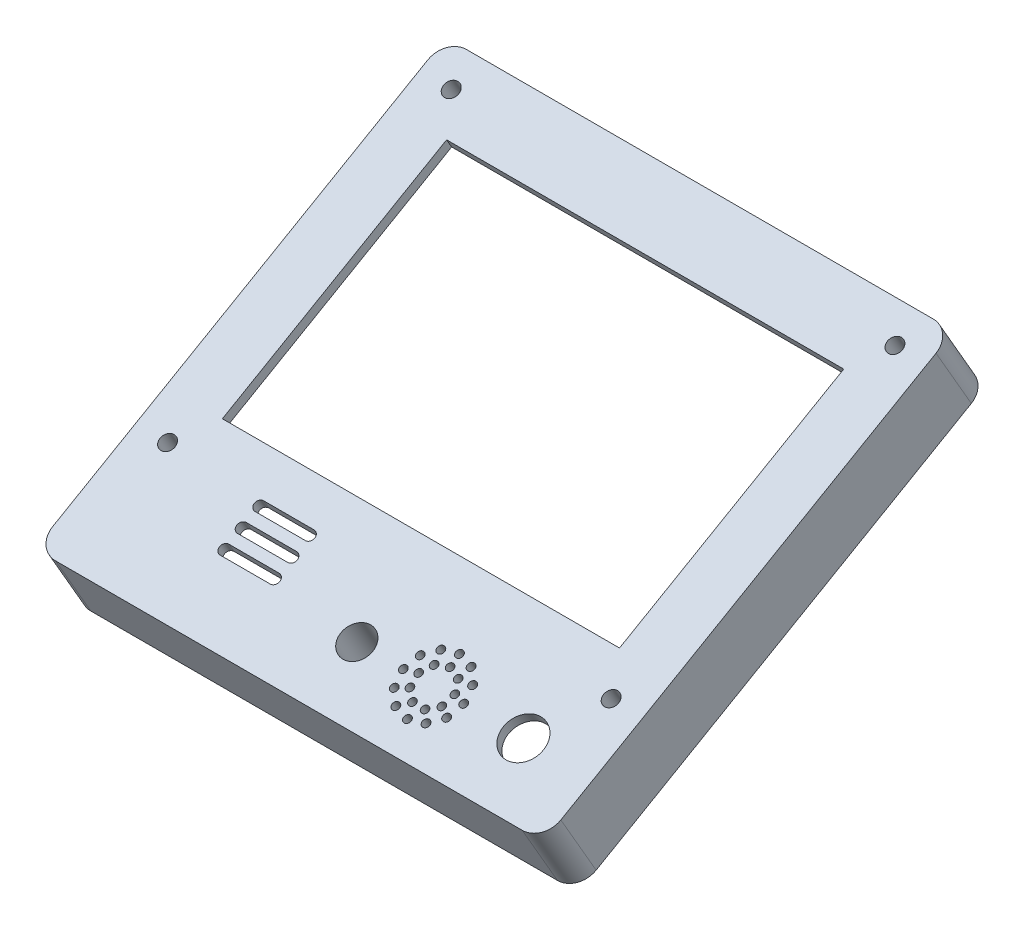
from build123d import *

# Parameters (mm, degrees)
SKETCH3_W           = 100751.030623597
SKETCH3_H           = 94095.793284763
BOSS_EXTRUDE1_DEPTH = 14000
SHELL1_T            = -2000
SKETCH5_R           = 1501.792292058
SKETCH5_R_2         = 1493.687333369
SKETCH5_R_3         = 1490.724890678
SKETCH5_R_4         = 3982.172835147
SKETCH5_R_5         = 3170.60939126
SKETCH5_R_6         = 1490.363986071
SKETCH5_R_7         = 737.911888342
SKETCH5_R_8         = 740.868588869
SKETCH5_R_9         = 724.590945863
SKETCH5_R_10        = 724.125890616
SKETCH5_R_11        = 734.985503275
SKETCH5_W           = 78736.278232061
SKETCH5_H           = 51336.053407304
CUT_EXTRUDE1_DEPTH  = 118262.071441258
SKETCH7_R           = 3521.682434345
SKETCH7_R_2         = 3500
SKETCH7_R_3         = 4000
BOSS_EXTRUDE2_DEPTH = 6300
SKETCH8_R           = 3170.60939126
SKETCH8_R_2         = 1490.363986071
SKETCH8_R_3         = 1501.792292058
SKETCH8_R_4         = 1493.687333369
SKETCH8_R_5         = 1490.724890678
CUT_EXTRUDE2_DEPTH  = 118101.300670381
FILLET1_R           = 4100


with BuildPart() as part:
    # Sketch3 → Boss-Extrude1 (new body)
    with BuildSketch(Plane(origin=(0, 38745.976565316, 22370), x_dir=(1, 0, 0), z_dir=(0, 0.866025403784438, 0.500000000000001))):
        with Locations((0.672101581, -53368.424582)):
            Rectangle(SKETCH3_W, SKETCH3_H)
    extrude(amount=BOSS_EXTRUDE1_DEPTH)

    # Shell1
    shell1_openings = [part.faces().sort_by_distance(p)[0] for p in [
        (0.672101581, 12061.764274316, 68588.411447965),
    ]]
    offset(amount=SHELL1_T, openings=shell1_openings, kind=Kind.INTERSECTION)

    # Sketch5 → Cut-Extrude1 (cut, through all)
    with BuildSketch(Plane(origin=(0, 50870.332218298, 29370), x_dir=(1, 0, 0), z_dir=(0, 0.8660254037844382, 0.500000000000001))):
        with Locations((-43988.642988716, -12447.86118339)):
            Circle(SKETCH5_R)
        with Locations((43969.858921507, -12425.496648286)):
            Circle(SKETCH5_R_2)
        with Locations((43990.171869975, -77427.118367554)):
            Circle(SKETCH5_R_3)
        with Locations((36420.678996585, -88766.891638688)):
            Circle(SKETCH5_R_4)
        with Locations((3383.428748484, -88760.799065072)):
            Circle(SKETCH5_R_5)
        with Locations((-43960.990588159, -77415.562559785)):
            Circle(SKETCH5_R_6)
        with Locations((12622.70964354, -88782.736651262)):
            Circle(SKETCH5_R_7)
        with Locations((13435.125802779, -91791.685227628)):
            Circle(SKETCH5_R_8)
        with Locations((15520.940800859, -90608.093588528)):
            Circle(SKETCH5_R_9)
        with Locations((15113.59271346, -88150.559972676)):
            Circle(SKETCH5_R_10)
        with Locations((16340.174739396, -86021.618091901)):
            Circle(SKETCH5_R_11)
        with Locations((18752.643650656, -85141.082169193)):
            Circle(SKETCH5_R_10)
        with Locations((21107.567803853, -86017.311065275)):
            Circle(SKETCH5_R_10)
        with Locations((22348.315287725, -88202.257409446)):
            Circle(SKETCH5_R_10)
        with Locations((21894.326565197, -90673.560524293)):
            Circle(SKETCH5_R_10)
        with Locations((19958.028005061, -92274.870216907)):
            Circle(SKETCH5_R_10)
        with Locations((17445.435223167, -92256.915885536)):
            Circle(SKETCH5_R_10)
        with Locations((13411.848268246, -85818.035470049)):
            Circle(SKETCH5_R_8)
        with Locations((15589.835663855, -83623.007736487)):
            Circle(SKETCH5_R_8)
        with Locations((18573.541944355, -82811.051655016)):
            Circle(SKETCH5_R_8)
        with Locations((21563.485421435, -83599.730201955)):
            Circle(SKETCH5_R_8)
        with Locations((23758.513154996, -85777.717597564)):
            Circle(SKETCH5_R_8)
        with Locations((24570.469236467, -88761.423878064)):
            Circle(SKETCH5_R_8)
        with Locations((23781.790689528, -91751.367355144)):
            Circle(SKETCH5_R_8)
        with Locations((21603.803293919, -93946.395088705)):
            Circle(SKETCH5_R_8)
        with Locations((18620.097013419, -94758.351170176)):
            Circle(SKETCH5_R_8)
        with Locations((15630.15353634, -93969.672623237)):
            Circle(SKETCH5_R_8)
        with BuildLine():
            Line((-24605.495027879, -77761.15742212), (-14621.25981654, -77761.15742212))
            ThreePointArc((-14621.25981654, -77761.15742212), (-13633.25454866, -78749.16269), (-14621.25981654, -79737.16795788))
            Line((-14621.25981654, -79737.16795788), (-24605.495027879, -79737.167957879))
            ThreePointArc((-24605.495027879, -79737.167957879), (-25593.500295759, -78749.16269), (-24605.495027879, -77761.15742212))
        make_face()
        with Locations((238.728370746, -44780.829769233)):
            Rectangle(SKETCH5_W, SKETCH5_H)
        with BuildLine():
            Line((-24597.360469483, -81751.779593879), (-14620.865597251, -81751.779593879))
            ThreePointArc((-14620.865597251, -81751.779593879), (-13613.569009088, -82759.076182042), (-14620.865597251, -83766.372770205))
            Line((-14620.865597251, -83766.372770205), (-24597.360469483, -83766.372770205))
            ThreePointArc((-24597.360469483, -83766.372770205), (-25604.657057646, -82759.076182042), (-24597.360469483, -81751.779593879))
        make_face()
        with BuildLine():
            Line((-24586.884137164, -85741.418474927), (-14643.554974413, -85741.418474927))
            ThreePointArc((-14643.554974413, -85741.418474927), (-13638.231381461, -86746.74206788), (-14643.554974413, -87752.065660833))
            Line((-14643.554974413, -87752.065660833), (-24586.884137164, -87752.065660833))
            ThreePointArc((-24586.884137164, -87752.065660833), (-25592.207730117, -86746.74206788), (-24586.884137164, -85741.418474927))
        make_face()
    extrude(amount=-CUT_EXTRUDE1_DEPTH, mode=Mode.SUBTRACT)

    # Sketch7 → Boss-Extrude2 (add)
    with BuildSketch(Plane(origin=(0, 49138.281410729, 28370), x_dir=(1, 0, 0), z_dir=(0, -0.8660254037844382, -0.500000000000001))):
        with Locations((43969.858921507, 12425.496648286)):
            Circle(SKETCH7_R)
        with Locations((-43988.642988716, 12447.86118339)):
            Circle(SKETCH7_R)
        with Locations((-43960.990588159, 77415.562559785)):
            Circle(SKETCH7_R_2)
        with Locations((43990.171869975, 77427.118367554)):
            Circle(SKETCH7_R)
        with Locations((3383.428748484, 88760.799065072)):
            Circle(SKETCH7_R_3)
    extrude(amount=BOSS_EXTRUDE2_DEPTH)

    # Sketch8 → Cut-Extrude2 (cut, through all)
    with BuildSketch(Plane(origin=(0, 49138.281410729, 28370), x_dir=(1, 0, 0), z_dir=(0, 0.8660254037844382, 0.5000000000000011))):
        with Locations((3383.428748484, -88760.799065072)):
            Circle(SKETCH8_R)
        with Locations((-43960.990588159, -77415.562559785)):
            Circle(SKETCH8_R_2)
        with Locations((-43988.642988716, -12447.86118339)):
            Circle(SKETCH8_R_3)
        with Locations((43969.858921507, -12425.496648286)):
            Circle(SKETCH8_R_4)
        with Locations((43990.171869975, -77427.118367554)):
            Circle(SKETCH8_R_5)
    extrude(amount=-CUT_EXTRUDE2_DEPTH, mode=Mode.SUBTRACT)

    # Fillet1
    fillet1_edges = [part.edges().sort_by_distance(p)[0] for p in [
        (-50374.843210217, 41647.890421998, 31343.737761038),
        (50376.18741338, 41647.890421998, 31343.737761038),
        (50376.18741338, -5400.006220383, 112833.085134892),
        (-50374.843210217, -5400.006220383, 112833.085134892),
    ]]
    fillet(fillet1_edges, radius=FILLET1_R)


solid = part.part
